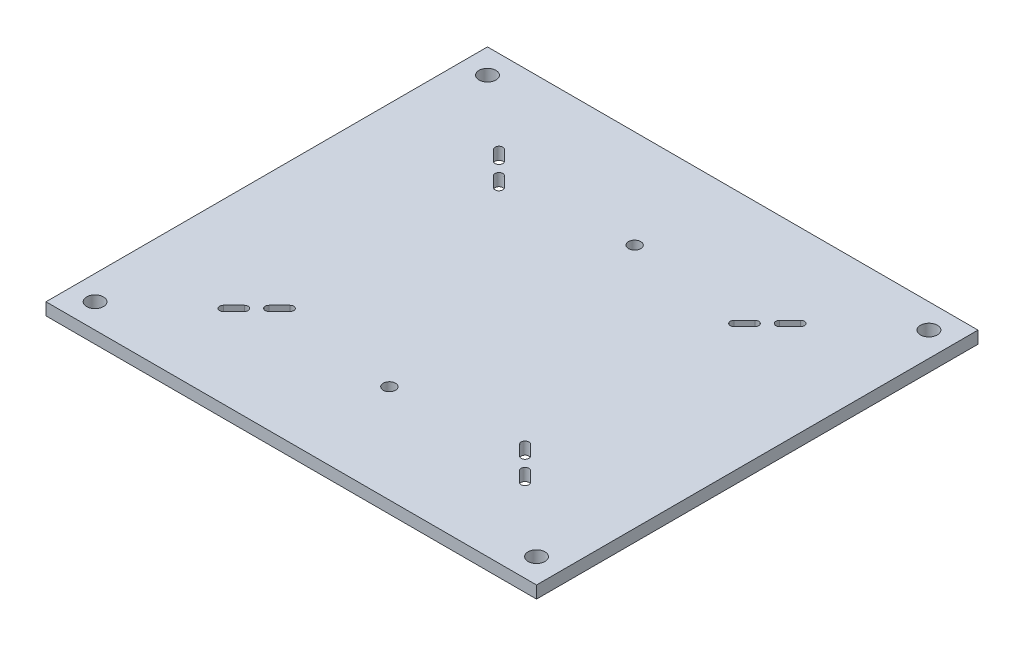
from build123d import *

# Parameters (mm, degrees)
SKETCH1_W                            = 254
SKETCH1_H                            = 228.6
BASE_PLATE_DEPTH                     = 6.35
SLOTS_DEPTH                          = 342.781044676
FEET_CONNECTION_HOLE_D               = 8.7376
HOLE_FOR_10_BLIND_FASTENERS_B_BS_1_D = 6.35


with BuildPart() as part:
    # Sketch1 → base plate (new body)
    with BuildSketch(Plane(origin=(0, 0, 0), x_dir=(1, 0, 0), z_dir=(0, 1, 0))):
        with Locations((127, -114.3)):
            Rectangle(SKETCH1_W, SKETCH1_H)
    extrude(amount=-BASE_PLATE_DEPTH)

    # Sketch3 → slots (cut, through all)
    with BuildSketch(Plane(origin=(0, 0, 0), x_dir=(1, 0, 0), z_dir=(0, 1, 0))):
        with BuildLine():
            Line((52.89618524, -178.825387544), (47.508031568, -184.213541217))
            ThreePointArc((47.508031568, -184.213541217), (47.508031568, -187.041968432), (50.336458783, -187.041968432))
            Line((50.336458783, -187.041968432), (55.724612456, -181.65381476))
            ThreePointArc((55.724612456, -181.65381476), (55.724612456, -178.825387544), (52.89618524, -178.825387544))
        make_face()
        with BuildLine():
            Line((62.145142119, -175.233285096), (67.533295792, -169.845131423))
            ThreePointArc((67.533295792, -169.845131423), (67.533295792, -167.016704208), (64.704868577, -167.016704208))
            Line((64.704868577, -167.016704208), (59.316714904, -172.404857881))
            ThreePointArc((59.316714904, -172.404857881), (59.316714904, -175.233285096), (62.145142119, -175.233285096))
        make_face()
        with BuildLine():
            ThreePointArc((50.336458783, -41.558031568), (47.508031568, -41.558031568), (47.508031568, -44.386458783))
            Line((47.508031568, -44.386458783), (52.89618524, -49.774612456))
            ThreePointArc((52.89618524, -49.774612456), (55.724612456, -49.774612456), (55.724612456, -46.94618524))
            Line((55.724612456, -46.94618524), (50.336458783, -41.558031568))
        make_face()
        with BuildLine():
            ThreePointArc((64.704868577, -61.583295792), (67.533295792, -61.583295792), (67.533295792, -58.754868577))
            Line((67.533295792, -58.754868577), (62.145142119, -53.366714904))
            ThreePointArc((62.145142119, -53.366714904), (59.316714904, -53.366714904), (59.316714904, -56.195142119))
            Line((59.316714904, -56.195142119), (64.704868577, -61.583295792))
        make_face()
        with BuildLine():
            Line((201.10381476, -49.774612456), (206.491968432, -44.386458783))
            ThreePointArc((206.491968432, -44.386458783), (206.491968432, -41.558031568), (203.663541217, -41.558031568))
            Line((203.663541217, -41.558031568), (198.275387544, -46.94618524))
            ThreePointArc((198.275387544, -46.94618524), (198.275387544, -49.774612456), (201.10381476, -49.774612456))
        make_face()
        with BuildLine():
            Line((191.854857881, -53.366714904), (186.466704208, -58.754868577))
            ThreePointArc((186.466704208, -58.754868577), (186.466704208, -61.583295792), (189.295131423, -61.583295792))
            Line((189.295131423, -61.583295792), (194.683285096, -56.195142119))
            ThreePointArc((194.683285096, -56.195142119), (194.683285096, -53.366714904), (191.854857881, -53.366714904))
        make_face()
        with BuildLine():
            ThreePointArc((189.295131423, -167.016704208), (186.466704208, -167.016704208), (186.466704208, -169.845131423))
            Line((186.466704208, -169.845131423), (191.854857881, -175.233285096))
            ThreePointArc((191.854857881, -175.233285096), (194.683285096, -175.233285096), (194.683285096, -172.404857881))
            Line((194.683285096, -172.404857881), (189.295131423, -167.016704208))
        make_face()
        with BuildLine():
            ThreePointArc((203.663541217, -187.041968432), (206.491968432, -187.041968432), (206.491968432, -184.213541217))
            Line((206.491968432, -184.213541217), (201.10381476, -178.825387544))
            ThreePointArc((201.10381476, -178.825387544), (198.275387544, -178.825387544), (198.275387544, -181.65381476))
            Line((198.275387544, -181.65381476), (203.663541217, -187.041968432))
        make_face()
    extrude(amount=-SLOTS_DEPTH, mode=Mode.SUBTRACT)

    # Feet connection hole (through all)
    with Locations(Plane(origin=(0, 0, 0), x_dir=(1, 0, 0), z_dir=(0, 1, 0))):
        with Locations((12.7, -215.9), (241.3, -12.7), (12.7, -12.7), (241.3, -215.9)):
            Hole(FEET_CONNECTION_HOLE_D / 2)

    # Hole for #10 Blind Fasteners (B,BS)1 (through all)
    with Locations(Plane(origin=(0, 0, 0), x_dir=(1, 0, 0), z_dir=(0, 1, 0))):
        with Locations((127, -177.8), (127, -50.8)):
            Hole(HOLE_FOR_10_BLIND_FASTENERS_B_BS_1_D / 2)


solid = part.part
